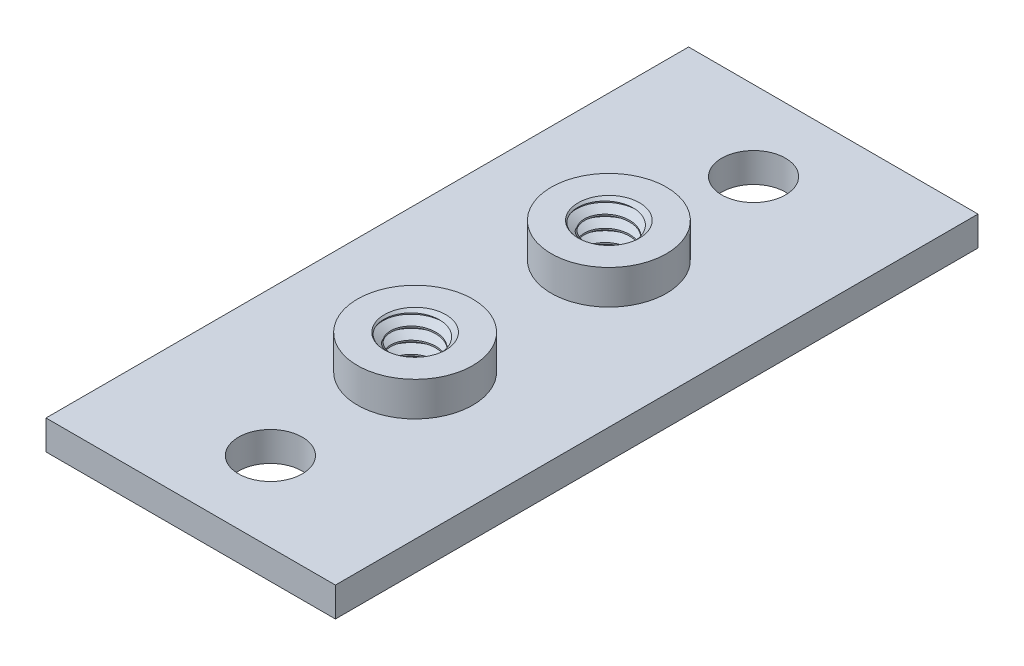
from build123d import *

# Parameters (mm, degrees)
BOSS_EXTRUDE1_START   = -3.302
SKETCH3_W             = 29.972
SKETCH3_H             = 66.548
SKETCH3_R             = 3.302
SKETCH3_R_2           = 3.175
BOSS_EXTRUDE1_DEPTH   = 3.048
SKETCH4_R             = 5.969
SKETCH4_R_2           = 3.175
BOSS_EXTRUDE2_DEPTH   = 3.556
SKETCH5_R             = 3.175
BOSS_EXTRUDE3_DEPTH   = 6.604
DELETEFACE1_START     = -3.302
DELETEFACE1_OUTLINE_R = 3.175
DELETEFACE1_DEPTH     = 6.604
CUT_SWEEP1_PITCH      = 1.27
LPATTERN1_COUNT       = 2
LPATTERN1_PITCH       = 20.066


with BuildPart() as part:
    # Sketch3 → Boss-Extrude1 (new body)
    with BuildSketch(Plane(origin=(0, 0, 0), x_dir=(1, 0, 0), z_dir=(0, 1, 0)).offset(BOSS_EXTRUDE1_START)):
        Rectangle(SKETCH3_W, SKETCH3_H)
        with Locations(Location((0, -25.019, 0), (0, 0, 90))):
            Circle(SKETCH3_R, mode=Mode.SUBTRACT)
        with Locations(Location((0, 25.019, 0), (0, 0, 90))):
            Circle(SKETCH3_R, mode=Mode.SUBTRACT)
        with Locations(Location((0, -10.033, 0), (0, 0, 90))):
            Circle(SKETCH3_R_2, mode=Mode.SUBTRACT)
        with Locations(Location((0, 10.033, 0), (0, 0, 90))):
            Circle(SKETCH3_R_2, mode=Mode.SUBTRACT)
    extrude(amount=BOSS_EXTRUDE1_DEPTH)

    # Sketch4 → Boss-Extrude2 (add)
    # profile 1 of 2: a face of its own
    with BuildSketch(Plane(origin=(0, -0.254, 0), x_dir=(1, 0, 0), z_dir=(0, 1, 0))):
        with Locations(Location((0, -10.033, 0), (0, 0, 90))):
            Circle(SKETCH4_R)
        with Locations(Location((0, -10.033, 0), (0, 0, 90))):
            Circle(SKETCH4_R_2, mode=Mode.SUBTRACT)
    # profile 2 of 2: a face of its own
    with BuildSketch(Plane(origin=(0, -0.254, 0), x_dir=(1, 0, 0), z_dir=(0, 1, 0))):
        with Locations(Location((0, 10.033, 0), (0, 0, 90))):
            Circle(SKETCH4_R)
        with Locations(Location((0, 10.033, 0), (0, 0, 90))):
            Circle(SKETCH4_R_2, mode=Mode.SUBTRACT)
    extrude(amount=BOSS_EXTRUDE2_DEPTH)

    # DeleteFace1: read off the stored shape, not the designer's step
    # DeleteFace1 outline → DeleteFace1 (add)
    with BuildSketch(Plane(origin=(0, 0, 0), x_dir=(1, 0, 0), z_dir=(0, 1, 0)).offset(DELETEFACE1_START)):
        with Locations((0, -10.033)):
            Circle(DELETEFACE1_OUTLINE_R)
        with Locations((0, 10.033)):
            Circle(DELETEFACE1_OUTLINE_R)
    extrude(amount=DELETEFACE1_DEPTH)


with BuildPart() as body_2:
    # Sketch5 → Boss-Extrude3 (new body)
    with BuildSketch(Plane(origin=(0, 3.302, 0), x_dir=(1, 0, 0), z_dir=(0, 1, 0))):
        with Locations(Location((0, -10.033, 0), (0, 0, 270))):
            Circle(SKETCH5_R)
    extrude(amount=-BOSS_EXTRUDE3_DEPTH)

    # Cut-Sweep1: arcs per turn and ends read off the stored shape
    # Cut-Sweep1: the profile of Sketch7 profile screwed along a right-hand helix through 7 turns, 8 arcs to a turn; built about Z, then put on its axis
    cut_sweep1_z = Axis((0, 0, 0), (0, 0, 1))
    cut_sweep1_corners = [(3.1753, 0, -1.269826795), (2.350110803, 0, -1.74625), (2.350110803, 0, -1.905), (3.1753, 0, -2.381423205)]
    with BuildLine(mode=Mode.PRIVATE) as cut_sweep1_profile:
        Line(cut_sweep1_corners[0], cut_sweep1_corners[1])
        Line(cut_sweep1_corners[1], cut_sweep1_corners[2])
        Line(cut_sweep1_corners[2], cut_sweep1_corners[3])
        Line(cut_sweep1_corners[3], cut_sweep1_corners[0])
    cut_sweep1_cap = Face(cut_sweep1_profile.wire())
    cut_sweep1_turn_angles = [0, 22.5, 45, 67.5, 90, 112.5, 135, 157.5, 180, 202.5, 225, 247.5, 270, 292.5, 315, 337.5, 360]
    cut_sweep1_turn_weights = [1, 0.9238795325112867, 1, 0.9238795325112867, 1, 0.9238795325112867, 1, 0.9238795325112867, 1, 0.9238795325112867, 1, 0.9238795325112867, 1, 0.9238795325112867, 1, 0.9238795325112867, 1]
    cut_sweep1_turn_rails = [Edge.make_bspline([Vector(p[0], p[1], 0).rotate(cut_sweep1_z, cut_sweep1_turn_angles[k]) / cut_sweep1_turn_weights[k] + Vector(0, 0, p[2] + CUT_SWEEP1_PITCH * cut_sweep1_turn_angles[k] / 360) for k in range(17)], [0, 0, 0, 1, 1, 2, 2, 3, 3, 4, 4, 5, 5, 6, 6, 7, 7, 8, 8, 8], 2, cut_sweep1_turn_weights) for p in cut_sweep1_corners]
    cut_sweep1_turn_sides = [Face.make_surface_from_curves(cut_sweep1_turn_rails[p[0]], cut_sweep1_turn_rails[p[1]]) for p in [(0, 1), (1, 2), (2, 3), (3, 0)]]
    cut_sweep1 = Plane(origin=(0, 3.302, 10.033), x_dir=(0, 0, 1), z_dir=(0, -1, 0)) * Solid(Shell([*[p.moved(Location((0, 0, CUT_SWEEP1_PITCH * i))) for i in range(7) for p in cut_sweep1_turn_sides], cut_sweep1_cap, cut_sweep1_cap.rotate(cut_sweep1_z, 2520).moved(Location((0, 0, CUT_SWEEP1_PITCH * 2520 / 360)))]))
    add(cut_sweep1, mode=Mode.SUBTRACT)


with BuildPart() as lpattern1_1:
    # LPattern1: pattern copy
    add(body_2.part.moved(Location(Vector(0, 0, -1) * (1 * LPATTERN1_PITCH))))


with BuildPart() as part_1:
    add(part.part)

    # Combine1: cut body 2, LPattern1_1
    add(body_2.part, mode=Mode.SUBTRACT)
    add(lpattern1_1.part, mode=Mode.SUBTRACT)

    # Cut-Extrude1 cone 1 section (through the dimple's axis) → Cut-Extrude1 (revolve, cut)
    with BuildSketch(Plane(origin=(0, 3.302, 10.033), x_dir=(0, 0, 1), z_dir=(1, 0, 0))):
        Polygon((0, 0), (3.175, 0), (0, 3.175), align=None)
    revolve(axis=Axis((0, 3.302, 10.033), (0, -1, 0)), mode=Mode.SUBTRACT)

    # Cut-Extrude1 cone 2 section (through the dimple's axis) → Cut-Extrude1 cone 2 (revolve, cut)
    with BuildSketch(Plane(origin=(0, 3.302, -10.033), x_dir=(0, 0, 1), z_dir=(1, 0, 0))):
        Polygon((0, 0), (3.175, 0), (0, 3.175), align=None)
    revolve(axis=Axis((0, 3.302, -10.033), (0, -1, 0)), mode=Mode.SUBTRACT)


solid = part_1.part
